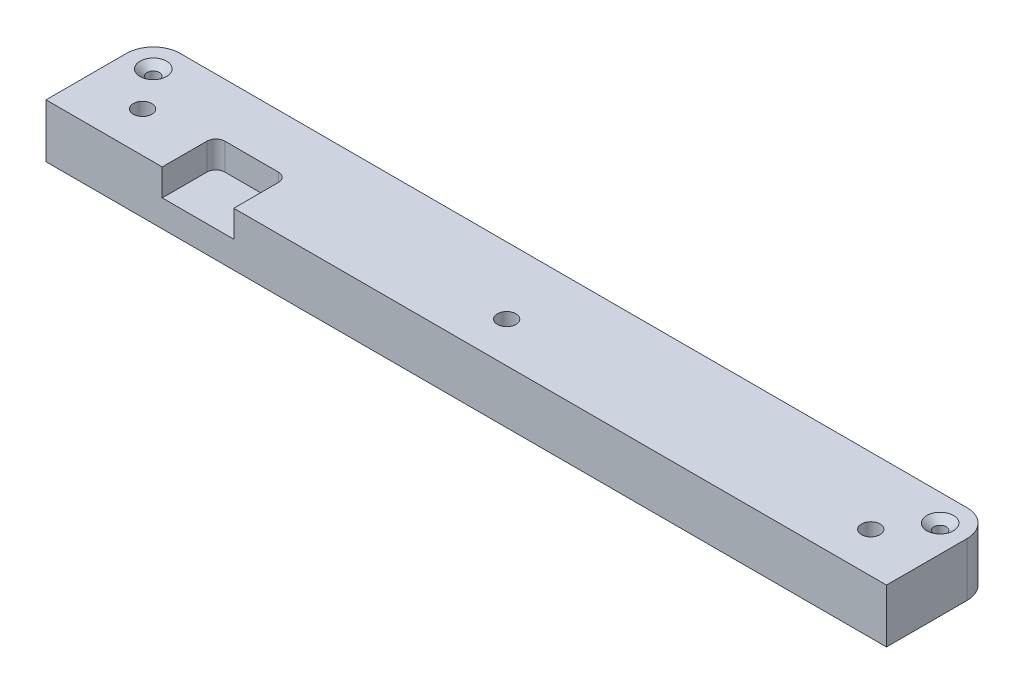
from build123d import *

# Parameters (mm, degrees)
SKETCH1_W           = 298.45
SKETCH1_H           = 38.1
BOSS_EXTRUDE1_DEPTH = 19.05
FILLET1_R           = 9.525
SKETCH2_R           = 3.302
CUT_EXTRUDE1_DEPTH  = 14.2875
SKETCH4_R           = 1.4224
CUT_EXTRUDE2_DEPTH  = 302.47456775
SKETCH5_R           = 2.413
CUT_EXTRUDE3_DEPTH  = 2.921
SKETCH6_R           = 2.1844
CUT_EXTRUDE4_DEPTH  = 302.47456775
CHAMFER1_SIZE       = 2.54
CHAMFER1_SIZE2      = 2.207988314
CUT_EXTRUDE5_START  = -5.08
SKETCH7_R           = 7.239
CUT_EXTRUDE5_DEPTH  = 297.39456775
CUT_EXTRUDE6_START  = -9.525
SKETCH8_W           = 25.4
SKETCH8_H           = 19.05
CUT_EXTRUDE6_DEPTH  = 9.525
FILLET2_R           = 3.175


with BuildPart() as part:
    # Sketch1 → Boss-Extrude1 (new body)
    with BuildSketch(Plane(origin=(0, 0, 0), x_dir=(1, 0, 0), z_dir=(0, 1, 0))):
        with Locations((149.225, 19.05)):
            Rectangle(SKETCH1_W, SKETCH1_H)
    extrude(amount=BOSS_EXTRUDE1_DEPTH)

    # Fillet1
    fillet1_edges = [part.edges().sort_by_distance(p)[0] for p in [
        (298.45, 9.525, -38.1),
        (0, 9.525, -38.1),
    ]]
    fillet(fillet1_edges, radius=FILLET1_R)

    # Sketch2 → Cut-Extrude1 (cut)
    with BuildSketch(Plane(origin=(0, 19.05, 0), x_dir=(1, 0, 0), z_dir=(0, 1, 0))):
        with Locations((19.939, 14.351)):
            Circle(SKETCH2_R)
        with Locations((149.225, 14.351)):
            Circle(SKETCH2_R)
        with Locations((278.511, 14.351)):
            Circle(SKETCH2_R)
    extrude(amount=-CUT_EXTRUDE1_DEPTH, mode=Mode.SUBTRACT)

    # Sketch4 → Cut-Extrude2 (cut, through all)
    with BuildSketch(Plane.XZ):
        with Locations((19.939, -14.351)):
            Circle(SKETCH4_R)
        with Locations((149.225, -14.351)):
            Circle(SKETCH4_R)
        with Locations((278.511, -14.351)):
            Circle(SKETCH4_R)
    extrude(amount=-CUT_EXTRUDE2_DEPTH, mode=Mode.SUBTRACT)

    # Sketch5 → Cut-Extrude3 (cut)
    with BuildSketch(Plane.XZ):
        with Locations((19.939, -14.351)):
            Circle(SKETCH5_R)
        with Locations((149.225, -14.351)):
            Circle(SKETCH5_R)
        with Locations((278.511, -14.351)):
            Circle(SKETCH5_R)
    extrude(amount=-CUT_EXTRUDE3_DEPTH, mode=Mode.SUBTRACT)

    # Sketch6 → Cut-Extrude4 (cut, through all)
    with BuildSketch(Plane(origin=(0, 19.05, 0), x_dir=(1, 0, 0), z_dir=(0, 1, 0))):
        with Locations((288.925, 28.575)):
            Circle(SKETCH6_R)
        with Locations((9.525, 28.575)):
            Circle(SKETCH6_R)
    extrude(amount=-CUT_EXTRUDE4_DEPTH, mode=Mode.SUBTRACT)

    # Chamfer1
    chamfer1_edges = [part.edges().sort_by_distance(p)[0] for p in [
        (286.7406, 19.05, -28.575),
        (7.3406, 19.05, -28.575),
    ]]
    chamfer1_side = [part.faces().sort_by_distance(p)[0] for p in [
        (149.225, 19.05, -19.008778326),
    ]]
    chamfer(chamfer1_edges, length=CHAMFER1_SIZE, length2=CHAMFER1_SIZE2, reference=chamfer1_side[0])

    # Sketch7 → Cut-Extrude5 (cut, through all)
    with BuildSketch(Plane(origin=(0, 19.05, 0), x_dir=(1, 0, 0), z_dir=(0, 1, 0)).offset(CUT_EXTRUDE5_START)):
        with Locations((149.225, 28.575)):
            Circle(SKETCH7_R)
    extrude(amount=-CUT_EXTRUDE5_DEPTH, mode=Mode.SUBTRACT)

    # Sketch8 → Cut-Extrude6 (cut)
    with BuildSketch(Plane.XZ.offset(CUT_EXTRUDE6_START)):
        with Locations((53.975, -9.525)):
            Rectangle(SKETCH8_W, SKETCH8_H)
    extrude(amount=-CUT_EXTRUDE6_DEPTH, mode=Mode.SUBTRACT)

    # Fillet2
    fillet2_edges = [part.edges().sort_by_distance(p)[0] for p in [
        (66.675, 14.2875, -19.05),
        (41.275, 14.2875, -19.05),
    ]]
    fillet(fillet2_edges, radius=FILLET2_R)


solid = part.part
